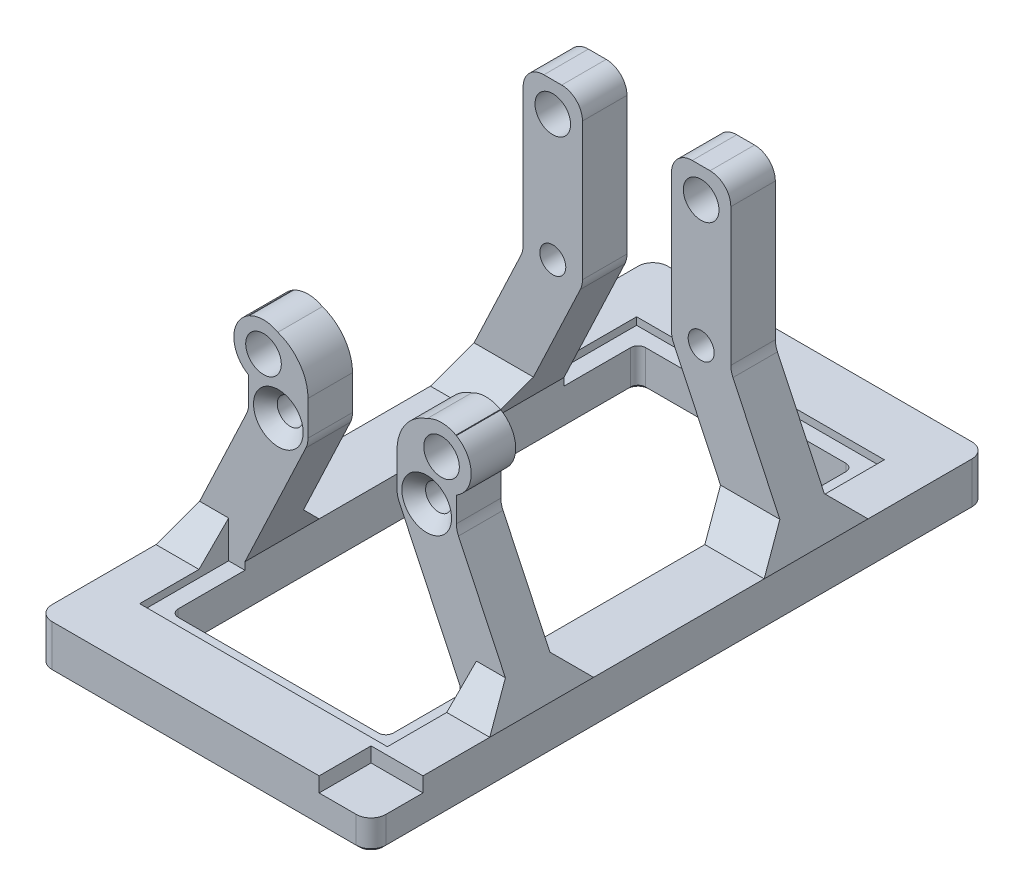
from build123d import *

# Parameters (mm, degrees)
SKETCH_1_R                = 1.75
EXTRUDE_1_DEPTH           = 6
SKETCH_3_W                = 45
SKETCH_3_H                = 11.5
CUT_EXTRUDE_1_DEPTH       = 10
SKETCH_14_R               = 2.4
SKETCH_14_R_2             = 2.779430085
CUT_EXTRUDE_8_DEPTH       = 4.5
EXTRUDE_START             = -0.2
SKETCH_23_R               = 1.75
EXTRUDE_9_DEPTH           = 0.2
EXTRUDE_4_DEPTH           = 6
EXTRUDE_4_DEPTH_BACK      = 37
SKETCH_11_W               = 53
SKETCH_11_H               = 31
CUT_EXTRUDE_6_DEPTH       = 109.610542766
SKETCH_7_R                = 1.75
CUT_EXTRUDE_2_DEPTH       = 85.964698552
CHAMFER_5_SIZE            = 4
SKETCH_22_W               = 7
SKETCH_22_H               = 7
CUT_EXTRUDE_14_DEPTH      = 2
FILLET_2_R                = 2
SKETCH_19_R               = 4
EXTRUDE_7_DEPTH           = 6
SKETCH_16_R               = 2.4
CUT_EXTRUDE_10_DEPTH      = 20
CUT_EXTRUDE_11_DEPTH      = 109.745114833
CUT_EXTRUDE_11_DEPTH_BACK = 1
SKETCH_17_W               = 33.4
SKETCH_17_H               = 12
FILLET_7_R                = 3
FILLET_8_R                = 6
CHAMFER_8_SIZE            = 1.6
SKETCH_24_W               = 8
SKETCH_24_H               = 6
EXTRUDE_10_DEPTH          = 11
SKETCH_21_R               = 2.4
CUT_EXTRUDE_13_DEPTH      = 10
FILLET_11_R               = 1
CHAMFER_9_SIZE            = 1.1
CHAMFER_10_SIZE           = 0.4
FILLET_12_R               = 2.8


with BuildPart() as part:
    # 草图1 → 凸台-拉伸1 (new body)
    with BuildSketch(Plane(origin=(0, 0, 0), x_dir=(1, 0, 0), z_dir=(0, 1, 0))):
        Polygon((0, -76), (0, -106), (45, -106), (45, 0), (0, 0), (0, -30), align=None)
        with Locations(Location((4, -32, 0), (0, 0, 270))):
            Circle(SKETCH_1_R, mode=Mode.SUBTRACT)
        with Locations(Location((41, -74, 0), (0, 0, 270))):
            Circle(SKETCH_1_R, mode=Mode.SUBTRACT)
        Polygon((8, -21.5), (37, -21.5), (37, -84.5), (8, -84.5), (8, -69), (8, -37), align=None, mode=Mode.SUBTRACT)
    extrude(amount=EXTRUDE_1_DEPTH)

    # 草图3 → 切除-拉伸1 (cut)
    with BuildSketch(Plane(origin=(0, 6, 0), x_dir=(1, 0, 0), z_dir=(0, 1, 0))):
        with Locations((22.5, -100.25)):
            Rectangle(SKETCH_3_W, SKETCH_3_H)
        with Locations((22.5, -5.75)):
            Rectangle(SKETCH_3_W, SKETCH_3_H)
    extrude(amount=-CUT_EXTRUDE_1_DEPTH, mode=Mode.SUBTRACT)

    # 草图14 → 切除-拉伸8 (cut)
    with BuildSketch(Plane(origin=(0, 0, 0), x_dir=(-1, 0, 0), z_dir=(0, -1, 0))):
        with Locations(Location((-41, -74, 0), (0, 0, 90))):
            Circle(SKETCH_14_R)
        with Locations(Location((-4, -32, 0), (0, 0, 90))):
            Circle(SKETCH_14_R_2)
    extrude(amount=-CUT_EXTRUDE_8_DEPTH, mode=Mode.SUBTRACT)

    # 草图23 → 凸台-拉伸9 (add)
    with BuildSketch(Plane(origin=(0, 6, 0), x_dir=(1, 0, 0), z_dir=(0, 1, 0)).offset(EXTRUDE_START)):
        with Locations(Location((4, -32, 0), (0, 0, 90))):
            Circle(SKETCH_23_R)
        with Locations(Location((41, -74, 0), (0, 0, 90))):
            Circle(SKETCH_23_R)
    extrude(amount=EXTRUDE_9_DEPTH)

    # 草图5 → 凸台-拉伸4 (add, two sides: drawn at the far end of the back side and taken through both)
    with BuildSketch(Plane.XY.offset(68.5).offset(-EXTRUDE_4_DEPTH_BACK)):
        Polygon((37, 6), (45, 6), (36.5, 24), (36.5, 35), (28.5, 35), (28.5, 24), align=None)
        Polygon((8.5, 24), (0, 6), (8, 6), (16.5, 24), (16.5, 35), (8.5, 35), align=None)
    extrude(amount=EXTRUDE_4_DEPTH + EXTRUDE_4_DEPTH_BACK)

    # 草图11 → 切除-拉伸6 (cut, through all)
    with BuildSketch(Plane(origin=(0, 6, 0), x_dir=(1, 0, 0), z_dir=(0, 1, 0))):
        with Locations((18.5, -53)):
            Rectangle(SKETCH_11_W, SKETCH_11_H)
    extrude(amount=CUT_EXTRUDE_6_DEPTH, mode=Mode.SUBTRACT)

    # 草图7 → 切除-拉伸2 (cut, through all)
    with BuildSketch(Plane.XY.offset(74.5)):
        with Locations((12.5, 25)):
            Circle(SKETCH_7_R)
        with Locations((32.5, 25)):
            Circle(SKETCH_7_R)
    extrude(amount=-CUT_EXTRUDE_2_DEPTH, mode=Mode.SUBTRACT)

    # 倒角5
    # the kernel refuses this chamfer: 4 mm, written as the material it adds along each edge
    with BuildSketch(Plane(origin=(0, 6, 31.5), x_dir=(0, -0.02749587661058627, -0.9996219169112968), z_dir=(1, 0, 0))) as chamfer_5_piece_1_section:
        Polygon((CHAMFER_5_SIZE * 0.999621916911, CHAMFER_5_SIZE * 0.0274958766106), (-CHAMFER_5_SIZE * 0.0274958766106, CHAMFER_5_SIZE * 0.999621916911), (0, 0), align=None)
    chamfer_5_piece_1 = extrude(amount=8, mode=Mode.PRIVATE)
    chamfer_5_piece_1 = split(chamfer_5_piece_1, bisect_by=Plane(origin=(1.267766081, 8.684681113, 30.146542015), z_dir=(0.9042486467459908, -0.42700630540782947, 0)), keep=Keep.TOP, mode=Mode.PRIVATE)
    chamfer_5_piece_1 = split(chamfer_5_piece_1, bisect_by=Plane(origin=(7.809091002, 5.595722122, 30.146542015), z_dir=(-0.9042486467459908, 0.42700630540782947, 0)), keep=Keep.TOP, mode=Mode.PRIVATE)
    add(chamfer_5_piece_1)
    with BuildSketch(Plane(origin=(0, 6, 31.5), x_dir=(0, -0.02749587661058627, -0.9996219169112968), z_dir=(1, 0, 0))) as chamfer_5_piece_2_section:
        Polygon((CHAMFER_5_SIZE * 0.999621916911, CHAMFER_5_SIZE * 0.0274958766106), (-CHAMFER_5_SIZE * 0.0274958766106, CHAMFER_5_SIZE * 0.999621916911), (0, 0), align=None)
    chamfer_5_piece_2 = extrude(amount=18.286731952, mode=Mode.PRIVATE)
    chamfer_5_piece_2 = split(chamfer_5_piece_2, bisect_by=Plane(origin=(8, 8.085139061, 30.588835888), z_dir=(1, 0, 0)), keep=Keep.TOP, mode=Mode.PRIVATE)
    chamfer_5_piece_2 = split(chamfer_5_piece_2, bisect_by=Plane(origin=(8.894881316, 7.895042787, 30.588835888), z_dir=(-0.9042486467459908, 0.42700630540782947, 0)), keep=Keep.TOP, mode=Mode.PRIVATE)
    add(chamfer_5_piece_2)
    with BuildSketch(Plane(origin=(0, 6, 74.5), x_dir=(0, -0.027495876610586296, 0.9996219169112968), z_dir=(1, 0, 0))) as chamfer_5_piece_3_section:
        Polygon((CHAMFER_5_SIZE * 0.999621916911, -CHAMFER_5_SIZE * 0.0274958766106), (-CHAMFER_5_SIZE * 0.0274958766106, -CHAMFER_5_SIZE * 0.999621916911), (0, 0), align=None)
    chamfer_5_piece_3 = extrude(amount=8, mode=Mode.PRIVATE)
    chamfer_5_piece_3 = split(chamfer_5_piece_3, bisect_by=Plane(origin=(1.267766081, 8.684681113, 75.853457985), z_dir=(0.9042486467459908, -0.42700630540782947, 0)), keep=Keep.TOP, mode=Mode.PRIVATE)
    chamfer_5_piece_3 = split(chamfer_5_piece_3, bisect_by=Plane(origin=(7.809091002, 5.595722122, 75.853457985), z_dir=(-0.9042486467459908, 0.42700630540782947, 0)), keep=Keep.TOP, mode=Mode.PRIVATE)
    add(chamfer_5_piece_3)
    with BuildSketch(Plane(origin=(0, 6, 74.5), x_dir=(0, -0.027495876610586296, 0.9996219169112968), z_dir=(1, 0, 0))) as chamfer_5_piece_4_section:
        Polygon((CHAMFER_5_SIZE * 0.999621916911, -CHAMFER_5_SIZE * 0.0274958766106), (-CHAMFER_5_SIZE * 0.0274958766106, -CHAMFER_5_SIZE * 0.999621916911), (0, 0), align=None)
    chamfer_5_piece_4 = extrude(amount=18.286731952, mode=Mode.PRIVATE)
    chamfer_5_piece_4 = split(chamfer_5_piece_4, bisect_by=Plane(origin=(8, 8.085139061, 75.411164112), z_dir=(1, 0, 0)), keep=Keep.TOP, mode=Mode.PRIVATE)
    chamfer_5_piece_4 = split(chamfer_5_piece_4, bisect_by=Plane(origin=(8.894881316, 7.895042787, 75.411164112), z_dir=(-0.9042486467459908, 0.42700630540782947, 0)), keep=Keep.TOP, mode=Mode.PRIVATE)
    add(chamfer_5_piece_4)
    with BuildSketch(Plane(origin=(26.713268048, 6, 31.5), x_dir=(0, -0.02749587661058627, -0.9996219169112968), z_dir=(1, 0, 0))) as chamfer_5_piece_5_section:
        Polygon((CHAMFER_5_SIZE * 0.999621916911, CHAMFER_5_SIZE * 0.0274958766106), (-CHAMFER_5_SIZE * 0.0274958766106, CHAMFER_5_SIZE * 0.999621916911), (0, 0), align=None)
    chamfer_5_piece_5 = extrude(amount=18.286731952, mode=Mode.PRIVATE)
    chamfer_5_piece_5 = split(chamfer_5_piece_5, bisect_by=Plane(origin=(37, 8.085139061, 30.588835888), z_dir=(-1, 0, 0)), keep=Keep.TOP, mode=Mode.PRIVATE)
    chamfer_5_piece_5 = split(chamfer_5_piece_5, bisect_by=Plane(origin=(36.105118684, 7.895042787, 30.588835888), z_dir=(0.904248646745991, 0.42700630540782875, 0)), keep=Keep.TOP, mode=Mode.PRIVATE)
    add(chamfer_5_piece_5)
    with BuildSketch(Plane(origin=(37, 6, 31.5), x_dir=(0, -0.02749587661058627, -0.9996219169112968), z_dir=(1, 0, 0))) as chamfer_5_piece_6_section:
        Polygon((CHAMFER_5_SIZE * 0.999621916911, CHAMFER_5_SIZE * 0.0274958766106), (-CHAMFER_5_SIZE * 0.0274958766106, CHAMFER_5_SIZE * 0.999621916911), (0, 0), align=None)
    chamfer_5_piece_6 = extrude(amount=8, mode=Mode.PRIVATE)
    chamfer_5_piece_6 = split(chamfer_5_piece_6, bisect_by=Plane(origin=(37.190908998, 5.595722122, 30.146542015), z_dir=(0.904248646745991, 0.42700630540782875, 0)), keep=Keep.TOP, mode=Mode.PRIVATE)
    chamfer_5_piece_6 = split(chamfer_5_piece_6, bisect_by=Plane(origin=(43.732233919, 8.684681113, 30.146542015), z_dir=(-0.9042486467459914, -0.42700630540782814, 0)), keep=Keep.TOP, mode=Mode.PRIVATE)
    add(chamfer_5_piece_6)
    with BuildSketch(Plane(origin=(26.713268048, 6, 74.5), x_dir=(0, -0.027495876610586296, 0.9996219169112968), z_dir=(1, 0, 0))) as chamfer_5_piece_7_section:
        Polygon((CHAMFER_5_SIZE * 0.999621916911, -CHAMFER_5_SIZE * 0.0274958766106), (-CHAMFER_5_SIZE * 0.0274958766106, -CHAMFER_5_SIZE * 0.999621916911), (0, 0), align=None)
    chamfer_5_piece_7 = extrude(amount=18.286731952, mode=Mode.PRIVATE)
    chamfer_5_piece_7 = split(chamfer_5_piece_7, bisect_by=Plane(origin=(37, 8.085139061, 75.411164112), z_dir=(-1, 0, 0)), keep=Keep.TOP, mode=Mode.PRIVATE)
    chamfer_5_piece_7 = split(chamfer_5_piece_7, bisect_by=Plane(origin=(36.105118684, 7.895042787, 75.411164112), z_dir=(0.904248646745991, 0.42700630540782875, 0)), keep=Keep.TOP, mode=Mode.PRIVATE)
    add(chamfer_5_piece_7)
    with BuildSketch(Plane(origin=(37, 6, 74.5), x_dir=(0, -0.027495876610586296, 0.9996219169112968), z_dir=(1, 0, 0))) as chamfer_5_piece_8_section:
        Polygon((CHAMFER_5_SIZE * 0.999621916911, -CHAMFER_5_SIZE * 0.0274958766106), (-CHAMFER_5_SIZE * 0.0274958766106, -CHAMFER_5_SIZE * 0.999621916911), (0, 0), align=None)
    chamfer_5_piece_8 = extrude(amount=8, mode=Mode.PRIVATE)
    chamfer_5_piece_8 = split(chamfer_5_piece_8, bisect_by=Plane(origin=(37.190908998, 5.595722122, 75.853457985), z_dir=(0.904248646745991, 0.42700630540782875, 0)), keep=Keep.TOP, mode=Mode.PRIVATE)
    chamfer_5_piece_8 = split(chamfer_5_piece_8, bisect_by=Plane(origin=(43.732233919, 8.684681113, 75.853457985), z_dir=(-0.9042486467459914, -0.42700630540782814, 0)), keep=Keep.TOP, mode=Mode.PRIVATE)
    add(chamfer_5_piece_8)
    with BuildSketch(Plane(origin=(18.286731952, 6, 68.5), x_dir=(0, -0.027495876610586296, -0.9996219169112968), z_dir=(-1, 0, 0))) as chamfer_5_piece_9_section:
        Polygon((CHAMFER_5_SIZE * 0.999621916911, -CHAMFER_5_SIZE * 0.0274958766106), (-CHAMFER_5_SIZE * 0.0274958766106, -CHAMFER_5_SIZE * 0.999621916911), (0, 0), align=None)
    chamfer_5_piece_9 = extrude(amount=18.286731952, mode=Mode.PRIVATE)
    chamfer_5_piece_9 = split(chamfer_5_piece_9, bisect_by=Plane(origin=(8, 8.085139061, 67.588835888), z_dir=(1, 0, 0)), keep=Keep.TOP, mode=Mode.PRIVATE)
    chamfer_5_piece_9 = split(chamfer_5_piece_9, bisect_by=Plane(origin=(8.894881316, 7.895042787, 67.588835888), z_dir=(-0.9042486467459908, 0.42700630540782947, 0)), keep=Keep.TOP, mode=Mode.PRIVATE)
    add(chamfer_5_piece_9)
    with BuildSketch(Plane(origin=(8, 6, 68.5), x_dir=(0, -0.027495876610586296, -0.9996219169112968), z_dir=(-1, 0, 0))) as chamfer_5_piece_10_section:
        Polygon((CHAMFER_5_SIZE * 0.999621916911, -CHAMFER_5_SIZE * 0.0274958766106), (-CHAMFER_5_SIZE * 0.0274958766106, -CHAMFER_5_SIZE * 0.999621916911), (0, 0), align=None)
    chamfer_5_piece_10 = extrude(amount=8, mode=Mode.PRIVATE)
    chamfer_5_piece_10 = split(chamfer_5_piece_10, bisect_by=Plane(origin=(1.267766081, 8.684681113, 67.146542015), z_dir=(0.9042486467459908, -0.42700630540782947, 0)), keep=Keep.TOP, mode=Mode.PRIVATE)
    chamfer_5_piece_10 = split(chamfer_5_piece_10, bisect_by=Plane(origin=(7.809091002, 5.595722122, 67.146542015), z_dir=(-0.9042486467459908, 0.42700630540782947, 0)), keep=Keep.TOP, mode=Mode.PRIVATE)
    add(chamfer_5_piece_10)
    with BuildSketch(Plane(origin=(45, 6, 68.5), x_dir=(0, -0.027495876610586296, -0.9996219169112968), z_dir=(-1, 0, 0))) as chamfer_5_piece_11_section:
        Polygon((CHAMFER_5_SIZE * 0.999621916911, -CHAMFER_5_SIZE * 0.0274958766106), (-CHAMFER_5_SIZE * 0.0274958766106, -CHAMFER_5_SIZE * 0.999621916911), (0, 0), align=None)
    chamfer_5_piece_11 = extrude(amount=8, mode=Mode.PRIVATE)
    chamfer_5_piece_11 = split(chamfer_5_piece_11, bisect_by=Plane(origin=(43.732233919, 8.684681113, 67.146542015), z_dir=(-0.9042486467459914, -0.42700630540782814, 0)), keep=Keep.TOP, mode=Mode.PRIVATE)
    chamfer_5_piece_11 = split(chamfer_5_piece_11, bisect_by=Plane(origin=(37.190908998, 5.595722122, 67.146542015), z_dir=(0.904248646745991, 0.42700630540782875, 0)), keep=Keep.TOP, mode=Mode.PRIVATE)
    add(chamfer_5_piece_11)
    with BuildSketch(Plane(origin=(45, 6, 68.5), x_dir=(0, -0.027495876610586296, -0.9996219169112968), z_dir=(-1, 0, 0))) as chamfer_5_piece_12_section:
        Polygon((CHAMFER_5_SIZE * 0.999621916911, -CHAMFER_5_SIZE * 0.0274958766106), (-CHAMFER_5_SIZE * 0.0274958766106, -CHAMFER_5_SIZE * 0.999621916911), (0, 0), align=None)
    chamfer_5_piece_12 = extrude(amount=18.286731952, mode=Mode.PRIVATE)
    chamfer_5_piece_12 = split(chamfer_5_piece_12, bisect_by=Plane(origin=(37, 8.085139061, 67.588835888), z_dir=(-1, 0, 0)), keep=Keep.TOP, mode=Mode.PRIVATE)
    chamfer_5_piece_12 = split(chamfer_5_piece_12, bisect_by=Plane(origin=(36.105118684, 7.895042787, 67.588835888), z_dir=(0.904248646745991, 0.42700630540782875, 0)), keep=Keep.TOP, mode=Mode.PRIVATE)
    add(chamfer_5_piece_12)
    with BuildSketch(Plane(origin=(0, 6, 37.5), x_dir=(0, -0.027495876610586296, 0.9996219169112968), z_dir=(1, 0, 0))) as chamfer_5_piece_13_section:
        Polygon((CHAMFER_5_SIZE * 0.999621916911, -CHAMFER_5_SIZE * 0.0274958766106), (-CHAMFER_5_SIZE * 0.0274958766106, -CHAMFER_5_SIZE * 0.999621916911), (0, 0), align=None)
    chamfer_5_piece_13 = extrude(amount=8, mode=Mode.PRIVATE)
    chamfer_5_piece_13 = split(chamfer_5_piece_13, bisect_by=Plane(origin=(1.267766081, 8.684681113, 38.853457985), z_dir=(0.9042486467459908, -0.42700630540782947, 0)), keep=Keep.TOP, mode=Mode.PRIVATE)
    chamfer_5_piece_13 = split(chamfer_5_piece_13, bisect_by=Plane(origin=(7.809091002, 5.595722122, 38.853457985), z_dir=(-0.9042486467459908, 0.42700630540782947, 0)), keep=Keep.TOP, mode=Mode.PRIVATE)
    add(chamfer_5_piece_13)
    with BuildSketch(Plane(origin=(0, 6, 37.5), x_dir=(0, -0.027495876610586296, 0.9996219169112968), z_dir=(1, 0, 0))) as chamfer_5_piece_14_section:
        Polygon((CHAMFER_5_SIZE * 0.999621916911, -CHAMFER_5_SIZE * 0.0274958766106), (-CHAMFER_5_SIZE * 0.0274958766106, -CHAMFER_5_SIZE * 0.999621916911), (0, 0), align=None)
    chamfer_5_piece_14 = extrude(amount=18.286731952, mode=Mode.PRIVATE)
    chamfer_5_piece_14 = split(chamfer_5_piece_14, bisect_by=Plane(origin=(8, 8.085139061, 38.411164112), z_dir=(1, 0, 0)), keep=Keep.TOP, mode=Mode.PRIVATE)
    chamfer_5_piece_14 = split(chamfer_5_piece_14, bisect_by=Plane(origin=(8.894881316, 7.895042787, 38.411164112), z_dir=(-0.9042486467459908, 0.42700630540782947, 0)), keep=Keep.TOP, mode=Mode.PRIVATE)
    add(chamfer_5_piece_14)
    with BuildSketch(Plane(origin=(26.713268048, 6, 37.5), x_dir=(0, -0.027495876610586296, 0.9996219169112968), z_dir=(1, 0, 0))) as chamfer_5_piece_15_section:
        Polygon((CHAMFER_5_SIZE * 0.999621916911, -CHAMFER_5_SIZE * 0.0274958766106), (-CHAMFER_5_SIZE * 0.0274958766106, -CHAMFER_5_SIZE * 0.999621916911), (0, 0), align=None)
    chamfer_5_piece_15 = extrude(amount=18.286731952, mode=Mode.PRIVATE)
    chamfer_5_piece_15 = split(chamfer_5_piece_15, bisect_by=Plane(origin=(37, 8.085139061, 38.411164112), z_dir=(-1, 0, 0)), keep=Keep.TOP, mode=Mode.PRIVATE)
    chamfer_5_piece_15 = split(chamfer_5_piece_15, bisect_by=Plane(origin=(36.105118684, 7.895042787, 38.411164112), z_dir=(0.904248646745991, 0.42700630540782875, 0)), keep=Keep.TOP, mode=Mode.PRIVATE)
    add(chamfer_5_piece_15)
    with BuildSketch(Plane(origin=(37, 6, 37.5), x_dir=(0, -0.027495876610586296, 0.9996219169112968), z_dir=(1, 0, 0))) as chamfer_5_piece_16_section:
        Polygon((CHAMFER_5_SIZE * 0.999621916911, -CHAMFER_5_SIZE * 0.0274958766106), (-CHAMFER_5_SIZE * 0.0274958766106, -CHAMFER_5_SIZE * 0.999621916911), (0, 0), align=None)
    chamfer_5_piece_16 = extrude(amount=8, mode=Mode.PRIVATE)
    chamfer_5_piece_16 = split(chamfer_5_piece_16, bisect_by=Plane(origin=(43.732233919, 8.684681113, 38.853457985), z_dir=(-0.9042486467459914, -0.42700630540782814, 0)), keep=Keep.TOP, mode=Mode.PRIVATE)
    chamfer_5_piece_16 = split(chamfer_5_piece_16, bisect_by=Plane(origin=(37.190908998, 5.595722122, 38.853457985), z_dir=(0.904248646745991, 0.42700630540782875, 0)), keep=Keep.TOP, mode=Mode.PRIVATE)
    add(chamfer_5_piece_16)

    # 草图22 → 切除-拉伸14 (cut)
    with BuildSketch(Plane(origin=(0, 6, 0), x_dir=(1, 0, 0), z_dir=(0, 1, 0))):
        with Locations((41.5, -91)):
            Rectangle(SKETCH_22_W, SKETCH_22_H)
    extrude(amount=-CUT_EXTRUDE_14_DEPTH, mode=Mode.SUBTRACT)

    # 圆角2
    fillet_2_edges = [part.edges().sort_by_distance(p)[0] for p in [
        (45, 2, 94.5),
        (0, 3, 94.5),
        (45, 3, 11.5),
        (0, 3, 11.5),
    ]]
    fillet(fillet_2_edges, radius=FILLET_2_R)

    # 草图19 → 凸台-拉伸7 (add)
    with BuildSketch(Plane.XY.offset(74.5)):
        with Locations((10.5, 31.5)):
            Circle(SKETCH_19_R)
        with Locations((34.5, 31.5)):
            Circle(SKETCH_19_R)
    extrude(amount=-EXTRUDE_7_DEPTH)

    # 草图16 → 切除-拉伸10 (cut)
    with BuildSketch(Plane.XY.offset(74.5)):
        with Locations((10.5, 31.5)):
            Circle(SKETCH_16_R)
        with Locations((34.5, 31.5)):
            Circle(SKETCH_16_R)
    extrude(amount=-CUT_EXTRUDE_10_DEPTH, mode=Mode.SUBTRACT)

    # 草图17 → 切除-拉伸11 (cut, two sides: drawn at the far end of the back side and taken through both)
    with BuildSketch(Plane(origin=(0, 6, 0), x_dir=(1, 0, 0), z_dir=(0, 1, 0)).offset(-CUT_EXTRUDE_11_DEPTH_BACK)):
        with Locations((22.5, -25.5)):
            Rectangle(SKETCH_17_W, SKETCH_17_H)
        with Locations((22.5, -80.5)):
            Rectangle(SKETCH_17_W, SKETCH_17_H)
    extrude(amount=CUT_EXTRUDE_11_DEPTH + CUT_EXTRUDE_11_DEPTH_BACK, mode=Mode.SUBTRACT)

    # 圆角7
    fillet_7_edges = [part.edges().sort_by_distance(p)[0] for p in [
        (16.5, 24, 34.5),
        (8.5, 24, 34.5),
        (36.5, 24, 34.5),
        (28.5, 24, 34.5),
        (36.5, 24, 71.5),
        (28.5, 24, 71.5),
        (16.5, 24, 71.5),
        (8.5, 24, 71.5),
    ]]
    fillet(fillet_7_edges, radius=FILLET_7_R)

    # 圆角8
    # the kernel refuses this fillet: 6 mm, written as the material it takes off along each edge
    with BuildSketch(Plane(origin=(16.5, 35, 88.697270865), x_dir=(0, -1, 0), z_dir=(0, 0, -1))) as fillet_8_piece_1:
        with BuildLine():
            CenterArc((5.678908346, 6), FILLET_8_R, 198.829231003, 71.170768997)
            Line((0, 4.063508327), (-0.113578167, 4.024778493))
            ThreePointArc((-0.113578167, 4.024778493), (-0.12, 2.031754163), (-0.12, 0))
            Line((-0.12, 0), (0, -0.12))
            Line((0, -0.12), (5.678908346, -0.12))
            Line((5.678908346, -0.12), (5.678908346, 0))
        make_face()
    extrude(amount=34.394541729, mode=Mode.SUBTRACT)
    with BuildSketch(Plane(origin=(28.5, 35, 88.697270865), x_dir=(1, 0, 0), z_dir=(0, 0, -1))) as fillet_8_piece_2:
        with BuildLine():
            CenterArc((6, 5.678908346), FILLET_8_R, 180, 71.170768997)
            Line((0, 5.678908346), (-0.12, 5.678908346))
            Line((-0.12, 5.678908346), (-0.12, 0))
            Line((-0.12, 0), (0, -0.12))
            ThreePointArc((0, -0.12), (2.031754163, -0.12), (4.024778493, -0.113578167))
            Line((4.024778493, -0.113578167), (4.063508327, 0))
        make_face()
    extrude(amount=34.394541729, mode=Mode.SUBTRACT)

    # 倒角8
    chamfer_8_edges = [part.edges().sort_by_distance(p)[0] for p in [
        (10.75, 25, 31.5),
        (10.75, 25, 74.5),
        (30.75, 25, 31.5),
        (30.75, 25, 74.5),
    ]]
    chamfer(chamfer_8_edges, length=CHAMFER_8_SIZE)

    # 草图24 → 凸台-拉伸10 (add)
    with BuildSketch(Plane(origin=(0, 35, 0), x_dir=(1, 0, 0), z_dir=(0, 1, 0))):
        with Locations((12.5, -34.5)):
            Rectangle(SKETCH_24_W, SKETCH_24_H)
        with Locations((32.5, -34.5)):
            Rectangle(SKETCH_24_W, SKETCH_24_H)
    extrude(amount=EXTRUDE_10_DEPTH)

    # 草图21 → 切除-拉伸13 (cut)
    with BuildSketch(Plane(origin=(0, 0, 31.5), x_dir=(-1, 0, 0), z_dir=(0, 0, -1))):
        with Locations((-32.5, 42)):
            Circle(SKETCH_21_R)
        with Locations((-12.5, 42)):
            Circle(SKETCH_21_R)
    extrude(amount=-CUT_EXTRUDE_13_DEPTH, mode=Mode.SUBTRACT)

    # 圆角11
    fillet_11_edges = [part.edges().sort_by_distance(p)[0] for p in [
        (37, 2.5, 21.5),
        (8, 2.5, 21.5),
        (37, 2.5, 84.5),
        (8, 2.5, 84.5),
    ]]
    fillet(fillet_11_edges, radius=FILLET_11_R)

    # 倒角9
    # the kernel refuses this chamfer: 1.1 mm, written as the material it adds along each edge
    with BuildSketch(Plane(origin=(4, 4.5, 32), x_dir=(0, 0, -1), z_dir=(-1, 0, 0))) as chamfer_9_piece_1_section:
        Polygon((2.779430085, CHAMFER_9_SIZE), (2.779430085 - CHAMFER_9_SIZE, 0), (2.779430085, 0), align=None)
    chamfer_9_piece_1 = revolve(axis=Axis((4, 4.5, 32), (0, -1, 0)), mode=Mode.PRIVATE)
    chamfer_9_piece_1 = chamfer_9_piece_1 - Plane(origin=(4, 3.914410119, 32), x_dir=(0, 0, 1), z_dir=(0, -1, 0)) * Cylinder(1.75, 12, mode=Mode.PRIVATE)
    add(chamfer_9_piece_1)
    with BuildSketch(Plane(origin=(41, 4.5, 74), x_dir=(0, 0, -1), z_dir=(-1, 0, 0))) as chamfer_9_piece_2_section:
        Polygon((2.4, CHAMFER_9_SIZE), (2.4 - CHAMFER_9_SIZE, 0), (2.4, 0), align=None)
    chamfer_9_piece_2 = revolve(axis=Axis((41, 4.5, 74), (0, -1, 0)), mode=Mode.PRIVATE)
    chamfer_9_piece_2 = chamfer_9_piece_2 - Plane(origin=(41, 3.723187314, 74), x_dir=(0, 0, 1), z_dir=(0, -1, 0)) * Cylinder(1.75, 10, mode=Mode.PRIVATE)
    add(chamfer_9_piece_2)

    # 倒角10
    chamfer_10_edges = [part.edges().sort_by_distance(p)[0] for p in [
        (22.5, 0, 11.5),
        (0, 0, 53),
        (45, 0, 53),
        (22.5, 0, 94.5),
        (0.585786438, 0, 93.914213562),
        (44.414213562, 0, 93.914213562),
        (44.414213562, 0, 12.085786438),
        (0.585786438, 0, 12.085786438),
        (22.5, 0, 21.5),
        (8, 0, 53),
        (22.5, 0, 84.5),
        (37, 0, 53),
        (8.292893219, 0, 21.792893219),
        (8.292893219, 0, 84.207106781),
        (36.707106781, 0, 84.207106781),
        (36.707106781, 0, 21.792893219),
        (41, 0, 76.4),
        (4, 0, 34.779430085),
    ]]
    chamfer(chamfer_10_edges, length=CHAMFER_10_SIZE)

    # 圆角12
    fillet_12_edges = [part.edges().sort_by_distance(p)[0] for p in [
        (16.5, 46, 34.5),
        (8.5, 46, 34.5),
        (28.5, 46, 34.5),
        (36.5, 46, 34.5),
    ]]
    fillet(fillet_12_edges, radius=FILLET_12_R)


solid = part.part
